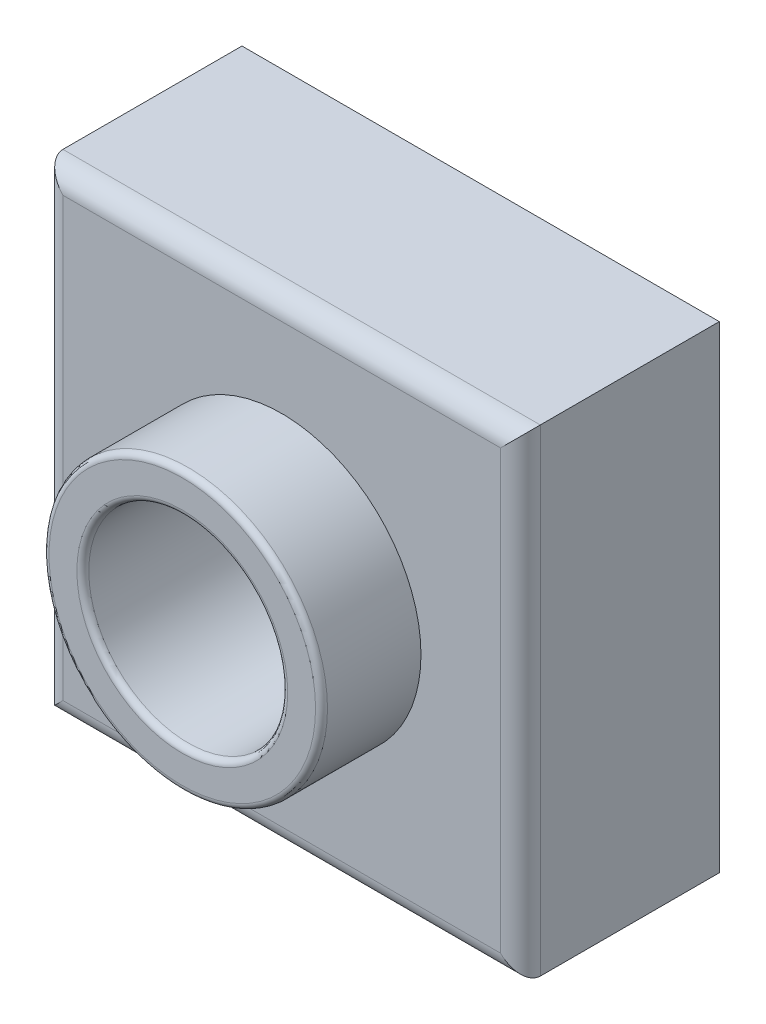
from build123d import *

# Parameters (mm, degrees)
SKETCH2_W            = 120
SKETCH2_H            = 120
BOSS_EXTRUDE1_DEPTH  = 50
SKETCH3_R            = 35
BOSS_EXTRUDE2_DEPTH  = 25
SKETCH4_R            = 25
CUT_EXTRUDE1_DEPTH   = 186.539753153
FILLET1_R            = 5
FILLET2_R            = 1.5
SHELL1_OUTLINE_W     = 116
SHELL1_OUTLINE_H     = 116
SHELL1_OUTLINE_R     = 27
SHELL1_DEPTH         = 45
SHELL1_2_OUTLINE_R   = 33
SHELL1_2_OUTLINE_R_2 = 27
SHELL1_2_DEPTH       = 73
SHELL1_START         = -118
SHELL1_3_DEPTH       = 116
SHELL1_START_2       = 1
SHELL1_4_DEPTH       = 118
SHELL1_START_3       = 45
SHELL1_5_OUTLINE_R   = 27
SHELL1_5_OUTLINE_R_2 = 25
SHELL1_5_DEPTH       = 3


with BuildPart() as part:
    # Sketch2 → Boss-Extrude1 (new body)
    with BuildSketch(Plane.XY):
        with Locations((-60, 60)):
            Rectangle(SKETCH2_W, SKETCH2_H)
    extrude(amount=BOSS_EXTRUDE1_DEPTH)

    # Sketch3 → Boss-Extrude2 (add)
    with BuildSketch(Plane.XY.offset(50)):
        with Locations((-60, 60)):
            Circle(SKETCH3_R)
    extrude(amount=BOSS_EXTRUDE2_DEPTH)

    # Sketch4 → Cut-Extrude1 (cut, through all)
    with BuildSketch(Plane.XY.offset(75)):
        with Locations((-60, 60)):
            Circle(SKETCH4_R)
    extrude(amount=-CUT_EXTRUDE1_DEPTH, mode=Mode.SUBTRACT)

    # Fillet1
    fillet1_edges = [part.edges().sort_by_distance(p)[0] for p in [
        (-120, 60, 50),
        (-60, 0, 50),
        (0, 60, 50),
        (-60, 120, 50),
    ]]
    fillet(fillet1_edges, radius=FILLET1_R)

    # Fillet2
    fillet2_edges = [part.edges().sort_by_distance(p)[0] for p in [
        (-95, 60, 75),
        (-85, 60, 75),
    ]]
    fillet(fillet2_edges, radius=FILLET2_R)

    # Shell1: read off the stored shape, not the designer's step
    # Shell1 outline → Shell1 (cut)
    with BuildSketch(Plane.XY):
        with Locations((-60, 60)):
            Rectangle(SHELL1_OUTLINE_W, SHELL1_OUTLINE_H)
        with Locations((-60, 60)):
            Circle(SHELL1_OUTLINE_R, mode=Mode.SUBTRACT)
    extrude(amount=SHELL1_DEPTH, mode=Mode.SUBTRACT)

    # Shell1 2 outline → Shell1 2 (cut)
    with BuildSketch(Plane.XY):
        with Locations((-60, 60)):
            Circle(SHELL1_2_OUTLINE_R)
        with Locations((-60, 60)):
            Circle(SHELL1_2_OUTLINE_R_2, mode=Mode.SUBTRACT)
    extrude(amount=SHELL1_2_DEPTH, mode=Mode.SUBTRACT)

    # Shell1 3 outline → Shell1 3 (cut)
    with BuildSketch(Plane.YZ.offset(SHELL1_START)):
        with BuildLine():
            ThreePointArc((118, 45), (117.121320344, 47.121320344), (115, 48))
            Line((115, 48), (5, 48))
            ThreePointArc((5, 48), (2.878679656, 47.121320344), (2, 45))
            Line((2, 45), (118, 45))
        make_face()
    extrude(amount=SHELL1_3_DEPTH, mode=Mode.SUBTRACT)

    # Shell1 4 outline → Shell1 4 (add)
    with BuildSketch(Plane(origin=(0, 0, 0), x_dir=(1, 0, 0), z_dir=(0, 1, 0)).offset(SHELL1_START_2)):
        with BuildLine():
            ThreePointArc((-2, -45), (-2.878679656, -47.121320344), (-5, -48))
            Line((-5, -48), (-2, -48))
            Line((-2, -48), (-2, -45))
        make_face()
        with BuildLine():
            ThreePointArc((-115, -48), (-117.121320344, -47.121320344), (-118, -45))
            Line((-118, -45), (-118, -48))
            Line((-118, -48), (-115, -48))
        make_face()
    extrude(amount=SHELL1_4_DEPTH)

    # Shell1 5 outline → Shell1 5 (add)
    with BuildSketch(Plane.XY.offset(SHELL1_START_3)):
        with Locations((-60, 60)):
            Circle(SHELL1_5_OUTLINE_R)
        with Locations((-60, 60)):
            Circle(SHELL1_5_OUTLINE_R_2, mode=Mode.SUBTRACT)
    extrude(amount=SHELL1_5_DEPTH)


solid = part.part
